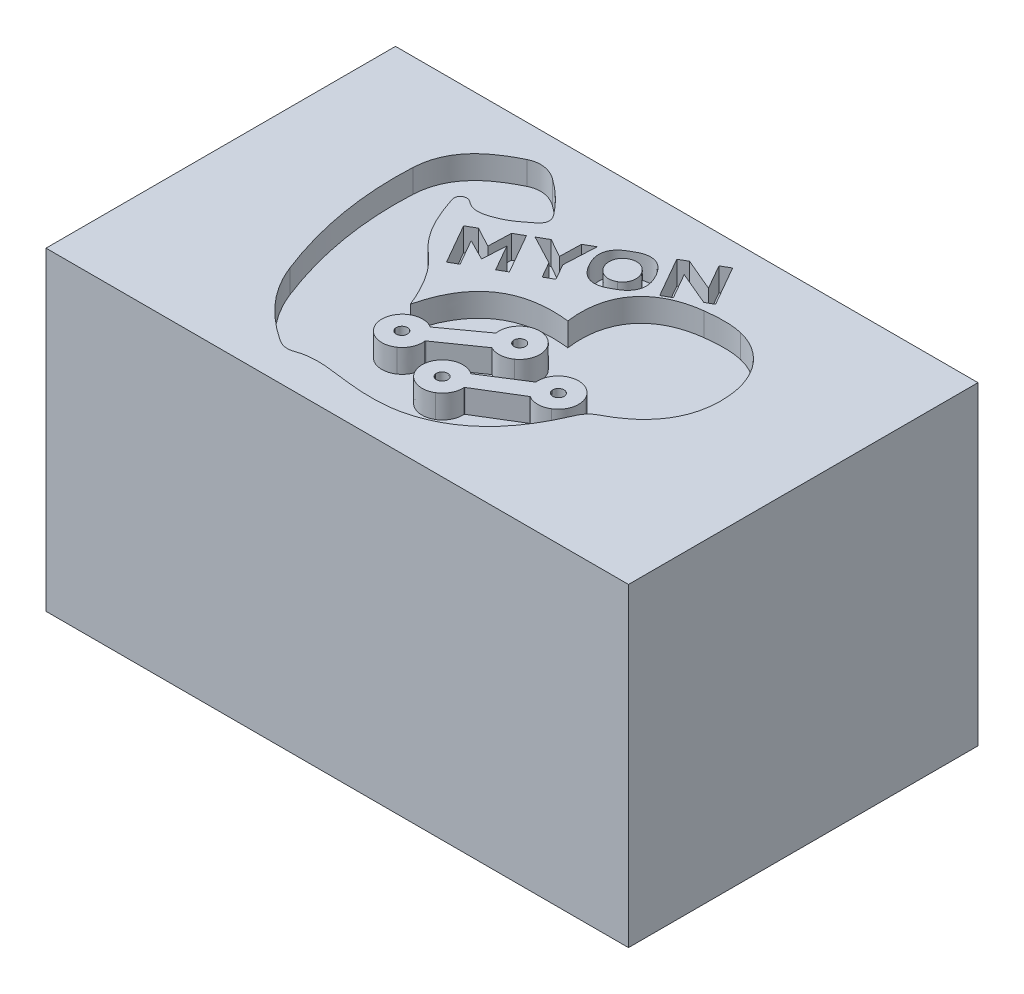
from build123d import *

# Parameters (mm, degrees)
SKETCH1_W               = 127
SKETCH1_H               = 76.2
BOSS_EXTRUDE1_DEPTH     = 63.5
SKETCH3_W               = 114.3
SKETCH3_H               = 63.5
CUT_EXTRUDE1_DEPTH      = 57.15
BOSS_EXTRUDE3_OUTLINE_W = 127
BOSS_EXTRUDE3_OUTLINE_H = 76.2
BOSS_EXTRUDE3_DEPTH     = 5.08


with BuildPart() as part:
    # Sketch1 → Boss-Extrude1 (new body)
    with BuildSketch(Plane(origin=(0, 0, 0), x_dir=(1, 0, 0), z_dir=(0, 1, 0))):
        with Locations((63.5, 38.1)):
            Rectangle(SKETCH1_W, SKETCH1_H)
    extrude(amount=BOSS_EXTRUDE1_DEPTH)

    # Sketch3 → Cut-Extrude1 (cut)
    with BuildSketch(Plane(origin=(0, 0, 0), x_dir=(1, 0, 0), z_dir=(0, 1, 0))):
        with Locations((63.5, 38.1)):
            Rectangle(SKETCH3_W, SKETCH3_H)
    extrude(amount=CUT_EXTRUDE1_DEPTH, mode=Mode.SUBTRACT)

    # Boss-Extrude3: read off the stored shape, not the designer's step
    # Boss-Extrude3 outline → Boss-Extrude3 (add)
    # profile 1 of 4: a face of its own
    with BuildSketch(Plane(origin=(0, 63.5, 0), x_dir=(1, 0, 0), z_dir=(0, 1, 0))):
        with Locations((63.5, 38.1)):
            Rectangle(BOSS_EXTRUDE3_OUTLINE_W, BOSS_EXTRUDE3_OUTLINE_H)
        Polygon((48.177404427, 42.102624982), (46.297457161, 41.025853497), (41.305513802, 49.740980451), (43.371992318, 50.924660138), (47.773832161, 48.551595685), (47.953666146, 53.548996076), (50.020392708, 54.73292381), (55.012584114, 46.017796857), (53.107584114, 44.926638654), (49.848496224, 50.616585919), (49.528267708, 45.488712872), (49.478410286, 45.460187482), (44.939896614, 47.755117169), align=None, mode=Mode.SUBTRACT)
        Polygon((61.472716927, 49.718160138), (59.555314583, 48.619808576), (57.587310677, 52.056001935), (51.214242318, 55.416665021), (53.455345833, 56.700431622), (57.538445443, 54.392851544), (57.651058724, 59.103633771), (59.829654427, 60.351681622), (59.483132943, 53.191808576), align=None, mode=Mode.SUBTRACT)
        with BuildLine():
            add(Edge.make_bspline(
                [(35.229008249, 53.016042263), (36.810412932, 48.331334892), (38.815520547, 43.941861019), (42.732961798, 40.625926577)],
                knots=[20, 20, 20, 20, 21, 21, 21, 21], degree=3))
            add(Edge.make_bspline(
                [(42.732961798, 40.625926577), (46.174479681, 37.712844661), (48.350409564, 33.84066896), (50.300186284, 29.158608863)],
                knots=[21, 21, 21, 21, 22, 22, 22, 22], degree=3))
            add(Edge.make_bspline(
                [(50.300186284, 29.158608863), (53.035865156, 40.454808583), (60.183824369, 44.34521592), (70.626650277, 43.14566193)],
                knots=[0, 0, 0, 0, 1, 1, 1, 1], degree=3))
            add(Edge.make_bspline(
                [(70.626650277, 43.14566193), (69.316879866, 52.732156773), (74.057486423, 58.746546124), (83.607810157, 59.907520448)],
                knots=[1, 1, 1, 1, 2, 2, 2, 2], degree=3))
            add(Edge.make_bspline(
                [(83.607810157, 59.907520448), (86.330192084, 60.238461871), (89.038920771, 60.384929568), (91.724960567, 59.744119812)],
                knots=[2, 2, 2, 2, 3, 3, 3, 3], degree=3))
            add(Edge.make_bspline(
                [(91.724960567, 59.744119812), (97.590174376, 58.344847996), (101.705528817, 53.258483471), (102.320501811, 46.710411704)],
                knots=[3, 3, 3, 3, 4, 4, 4, 4], degree=3))
            add(Edge.make_bspline(
                [(102.320501811, 46.710411704), (103.054427589, 38.895667019), (99.573692271, 32.838677208), (91.891884964, 28.830866973)],
                knots=[4, 4, 4, 4, 5, 5, 5, 5], degree=3))
            add(Edge.make_bspline(
                [(91.891884964, 28.830866973), (90.557074112, 28.134462664), (89.804364441, 27.246285916), (89.216355883, 25.88079803)],
                knots=[5, 5, 5, 5, 6, 6, 6, 6], degree=3))
            add(Edge.make_bspline(
                [(89.216355883, 25.88079803), (85.740551693, 17.809171484), (80.631532125, 11.281020194), (71.900171193, 8.417880204)],
                knots=[6, 6, 6, 6, 7, 7, 7, 7], degree=3))
            add(Edge.make_bspline(
                [(71.900171193, 8.417880204), (66.656336569, 6.698355826), (61.280095447, 7.154948387), (55.953917393, 7.841600891)],
                knots=[7, 7, 7, 7, 8, 8, 8, 8], degree=3))
            add(Edge.make_bspline(
                [(55.953917393, 7.841600891), (52.767799182, 8.252352485), (49.645575426, 8.71344862), (46.534514405, 7.562792611)],
                knots=[8, 8, 8, 8, 9, 9, 9, 9], degree=3))
            add(Edge.make_bspline(
                [(46.534514405, 7.562792611), (45.162297881, 7.055271185), (43.949277705, 7.442101106), (42.79459734, 8.211064974)],
                knots=[9, 9, 9, 9, 10, 10, 10, 10], degree=3))
            add(Edge.make_bspline(
                [(42.79459734, 8.211064974), (37.236219789, 11.912639309), (32.792959561, 16.53366244), (30.310937186, 22.881036568)],
                knots=[10, 10, 10, 10, 11, 11, 11, 11], degree=3))
            add(Edge.make_bspline(
                [(30.310937186, 22.881036568), (26.236546919, 33.300653393), (24.201349267, 44.064202172), (24.770811758, 55.257268624)],
                knots=[11, 11, 11, 11, 12, 12, 12, 12], degree=3))
            add(Edge.make_bspline(
                [(24.770811758, 55.257268624), (25.133856288, 62.393087071), (29.855261195, 66.300015826), (35.680030132, 69.154348193)],
                knots=[12, 12, 12, 12, 13, 13, 13, 13], degree=3))
            add(Edge.make_bspline(
                [(35.680030132, 69.154348193), (37.838651185, 70.212144713), (40.120441777, 69.722781882), (42.095841481, 68.322352105)],
                knots=[13, 13, 13, 13, 14, 14, 14, 14], degree=3))
            add(Edge.make_bspline(
                [(42.095841481, 68.322352105), (44.712002841, 66.467667066), (47.008601071, 64.271875495), (48.982213953, 61.732168003)],
                knots=[14, 14, 14, 14, 15, 15, 15, 15], degree=3))
            add(Edge.make_bspline(
                [(48.982213953, 61.732168003), (50.034938607, 60.377486557), (50.013225965, 59.282811682), (48.615618048, 58.146462715)],
                knots=[15, 15, 15, 15, 16, 16, 16, 16], degree=3))
            add(Edge.make_bspline(
                [(48.615618048, 58.146462715), (46.792832137, 56.664412787), (44.930882234, 55.268228271), (42.6818726, 54.523599379)],
                knots=[16, 16, 16, 16, 17, 17, 17, 17], degree=3))
            add(Edge.make_bspline(
                [(42.6818726, 54.523599379), (40.961261521, 53.953915093), (39.222577358, 53.54979772), (37.58608228, 54.864050327)],
                knots=[17, 17, 17, 17, 18, 18, 18, 18], degree=3))
            add(Edge.make_bspline(
                [(37.58608228, 54.864050327), (36.939728568, 55.383129976), (36.136168416, 55.546548426), (35.442088935, 54.965391428)],
                knots=[18, 18, 18, 18, 19, 19, 19, 19], degree=3))
            add(Edge.make_bspline(
                [(35.442088935, 54.965391428), (34.80601969, 54.432808184), (35.001180497, 53.690961959), (35.229008249, 53.016042263)],
                knots=[19, 19, 19, 19, 20, 20, 20, 20], degree=3))
        make_face(mode=Mode.SUBTRACT)
        with BuildLine():
            Line((71.635693489, 61.359744122), (71.650080208, 61.334691388))
            add(Edge.make_bspline(
                [(71.650080208, 61.334691388), (73.069404427, 58.857199201), (72.278921121, 55.716419755), (70.493338685, 54.686719627), (69.601529763, 54.175874628)],
                knots=[0, 0, 0, 0, 1, 1.99488597, 1.99488597, 1.99488597, 1.99488597], degree=3))
            add(Edge.make_bspline(
                [(69.601529763, 54.175874628), (69.596964834, 54.173244114), (69.592394408, 54.170618254), (69.587818489, 54.167997052)],
                knots=[4.998298331, 4.998298331, 4.998298331, 4.998298331, 5, 5, 5, 5], degree=3))
            add(Edge.make_bspline(
                [(69.587818489, 54.167997052), (69.58321471, 54.165360134), (69.578609792, 54.162730364), (69.574003744, 54.160107739)],
                knots=[5, 5, 5, 5, 5.001711872, 5.001711872, 5.001711872, 5.001711872], degree=3))
            add(Edge.make_bspline(
                [(69.574003744, 54.160107739), (68.68218599, 53.649293073), (66.89061189, 52.629928294), (63.820480599, 53.526671857), (62.401404427, 56.004412091)],
                knots=[2.005121732, 2.005121732, 2.005121732, 2.005121732, 3, 4, 4, 4, 4], degree=3))
            Line((62.401404427, 56.004412091), (62.387017708, 56.028968732))
            add(Edge.make_bspline(
                [(62.387017708, 56.028968732), (60.968189583, 58.506708966), (61.760203255, 61.655912091), (64.449527474, 63.196283185), (67.138603646, 64.736654279), (70.216617318, 63.83723631), (71.635693489, 61.359744122)],
                knots=[0, 0, 0, 0, 1, 2, 3, 4, 4, 4, 4], degree=3))
        make_face(mode=Mode.SUBTRACT)
        Polygon((77.742607552, 59.037529279), (75.850257943, 57.953564435), (70.858314583, 66.668691388), (72.625896614, 67.681218732), (79.783537239, 64.654302716), (76.709740364, 70.020300763), (78.602338021, 71.104265607), (83.59428138, 62.389138654), (81.963373177, 61.454994122), (74.569095833, 64.577904279), align=None, mode=Mode.SUBTRACT)
    # profile 2 of 4: a face of its own
    with BuildSketch(Plane(origin=(0, 63.5, 0), x_dir=(1, 0, 0), z_dir=(0, 1, 0))):
        with BuildLine():
            Line((64.377345833, 57.202230451), (64.391732552, 57.177177716))
            add(Edge.make_bspline(
                [(64.391732552, 57.177177716), (65.247494271, 55.683191388), (67.056252083, 55.065802716), (68.600095833, 55.950089826)],
                knots=[4, 4, 4, 4, 5, 5, 5, 5], degree=3))
            add(Edge.make_bspline(
                [(68.600095833, 55.950089826), (70.143939583, 56.834376935), (70.515513802, 58.667815411), (69.659752083, 60.162049786)],
                knots=[5, 5, 5, 5, 6, 6, 6, 6], degree=3))
            Line((69.659752083, 60.162049786), (69.645613411, 60.186606427))
            add(Edge.make_bspline(
                [(69.645613411, 60.186606427), (68.789603646, 61.680840802), (66.98109388, 62.298229474), (65.43725013, 61.413942365)],
                knots=[1, 1, 1, 1, 2, 2, 2, 2], degree=3))
            add(Edge.make_bspline(
                [(65.43725013, 61.413942365), (63.89340638, 60.529655255), (63.521584114, 58.696216779), (64.377345833, 57.202230451)],
                knots=[2, 2, 2, 2, 3, 3, 3, 3], degree=3))
        make_face()
    # profile 3 of 4: a face of its own
    with BuildSketch(Plane(origin=(0, 63.5, 0), x_dir=(1, 0, 0), z_dir=(0, 1, 0))):
        with BuildLine():
            add(Edge.make_bspline(
                [(80.888400373, 24.706120166), (80.860531862, 24.722168752), (80.806318726, 24.756051993)],
                knots=[15, 15, 15, 16, 16, 16], degree=2))
            add(Edge.make_bspline(
                [(85.430007023, 24.765028015), (83.992544696, 23.885694795), (82.252597934, 23.920522281), (80.888400373, 24.706120166)],
                knots=[14, 14, 14, 14, 15, 15, 15, 15], degree=3))
            add(Edge.make_bspline(
                [(86.902263928, 30.876370716), (88.183312097, 28.78221751), (87.524160228, 26.046076184), (85.430007023, 24.765028015)],
                knots=[13, 13, 13, 13, 14, 14, 14, 14], degree=3))
            add(Edge.make_bspline(
                [(80.790921227, 32.348627621), (82.885074433, 33.62967579), (85.621215759, 32.970523921), (86.902263928, 30.876370716)],
                knots=[12, 12, 12, 12, 13, 13, 13, 13], degree=3))
            add(Edge.make_bspline(
                [(78.68823876, 28.097343599), (78.518012846, 29.746891252), (79.281914102, 31.42552858), (80.790921227, 32.348627621)],
                knots=[11, 11, 11, 11, 12, 12, 12, 12], degree=3))
            add(Edge.make_bspline(
                [(70.120942364, 22.672218689), (71.076054841, 23.276990174), (78.686201693, 28.095700542), (78.688238359, 28.097343183), (78.688238507, 28.097343303), (78.688238656, 28.097343423), (78.68823876, 28.097343599)],
                knots=[10, 10, 10, 10, 10.9998478, 10.9998478, 10.9998478, 10.999920778, 10.999920778, 10.999920778, 10.999920778], degree=3))
            Line((70.120942364, 22.672218689), (70.022877884, 22.610124898))
            add(Edge.make_bspline(
                [(69.910538964, 22.687664211), (69.948308815, 22.662691589), (70.022877884, 22.610124898)],
                knots=[8, 8, 8, 9, 9, 9], degree=2))
            add(Edge.make_bspline(
                [(65.136433452, 22.772368898), (66.656924383, 23.702492883), (68.515852253, 23.609801427), (69.910538964, 22.687664211)],
                knots=[7, 7, 7, 7, 8, 8, 8, 8], degree=3))
            add(Edge.make_bspline(
                [(63.664176547, 16.661026198), (62.383128378, 18.755179403), (63.042280247, 21.491320729), (65.136433452, 22.772368898)],
                knots=[6, 6, 6, 6, 7, 7, 7, 7], degree=3))
            add(Edge.make_bspline(
                [(69.775519248, 15.188769293), (67.681366042, 13.907721124), (64.945224716, 14.566872992), (63.664176547, 16.661026198)],
                knots=[5, 5, 5, 5, 6, 6, 6, 6], degree=3))
            add(Edge.make_bspline(
                [(71.897664517, 19.172028952), (71.963536984, 17.610974898), (71.202836789, 16.061896683), (69.775519248, 15.188769293)],
                knots=[4, 4, 4, 4, 5, 5, 5, 5], degree=3))
            add(Edge.make_bspline(
                [(71.8890736, 19.318245202), (71.892746059, 19.269508248), (71.895608075, 19.220762764), (71.897664517, 19.172028952)],
                knots=[3, 3, 3, 3, 4, 4, 4, 4], degree=3))
            Line((71.8890736, 19.318245202), (72.009826973, 19.39246082))
            Line((72.009826973, 19.39246082), (80.806318726, 24.756051993))
        make_face()
        with BuildLine():
            add(Edge.make_bspline(
                [(66.189170149, 18.754168867), (66.08941144, 19.429975412), (66.556390478, 20.058695275), (67.232197024, 20.158453985), (67.90800357, 20.258212694), (68.536723433, 19.791233656), (68.636482142, 19.11542711)],
                knots=[0, 0, 0, 0, 1, 1, 1, 2, 2, 2, 2], degree=3))
            add(Edge.make_bspline(
                [(68.636482142, 19.11542711), (68.736240852, 18.439620564), (68.269261813, 17.810900701), (67.593455268, 17.711141992), (66.917648722, 17.611383283), (66.288928859, 18.078362321), (66.189170149, 18.754168867)],
                knots=[2, 2, 2, 2, 3, 3, 3, 4, 4, 4, 4], degree=3))
        make_face(mode=Mode.SUBTRACT)
        with BuildLine():
            add(Edge.make_bspline(
                [(82.00370618, 28.301495139), (81.903947471, 28.977301685), (82.370926509, 29.606021548), (83.046733055, 29.705780258), (83.722539601, 29.805538967), (84.351259463, 29.338559929), (84.451018173, 28.662753383)],
                knots=[0, 0, 0, 0, 1, 1, 1, 2, 2, 2, 2], degree=3))
            add(Edge.make_bspline(
                [(84.451018173, 28.662753383), (84.550776882, 27.986946837), (84.083797844, 27.358226974), (83.407991298, 27.258468265), (82.732184752, 27.158709555), (82.103464889, 27.625688594), (82.00370618, 28.301495139)],
                knots=[2, 2, 2, 2, 3, 3, 3, 4, 4, 4, 4], degree=3))
        make_face(mode=Mode.SUBTRACT)
    # profile 4 of 4: a face of its own
    with BuildSketch(Plane(origin=(0, 63.5, 0), x_dir=(1, 0, 0), z_dir=(0, 1, 0))):
        with BuildLine():
            add(Edge.make_bspline(
                [(67.49912133, 29.763798095), (67.470315206, 29.778095585), (67.414113671, 29.808567303)],
                knots=[15, 15, 15, 16, 16, 16], degree=2))
            add(Edge.make_bspline(
                [(72.028428264, 30.10297326), (70.647994191, 29.13657447), (68.909216228, 29.063918533), (67.49912133, 29.763798095)],
                knots=[14, 14, 14, 14, 15, 15, 15, 15], degree=3))
            add(Edge.make_bspline(
                [(73.120588301, 36.293549683), (74.52847711, 34.282477542), (74.039500406, 31.510862069), (72.028428264, 30.10297326)],
                knots=[13, 13, 13, 13, 14, 14, 14, 14], degree=3))
            add(Edge.make_bspline(
                [(66.930011877, 37.38570972), (68.941084019, 38.793598529), (71.712699491, 38.304621825), (73.120588301, 36.293549683)],
                knots=[12, 12, 12, 12, 13, 13, 13, 13], degree=3))
            add(Edge.make_bspline(
                [(65.093796604, 33.012724142), (64.822059262, 34.648616295), (65.480871392, 36.371211717), (66.930011877, 37.38570972)],
                knots=[11, 11, 11, 11, 12, 12, 12, 12], degree=3))
            add(Edge.make_bspline(
                [(56.877766477, 27.069038689), (57.793721056, 27.731621214), (65.091864858, 33.01095846), (65.093796229, 33.012723703), (65.09379637, 33.012723831), (65.093796511, 33.01272396), (65.093796604, 33.012724142)],
                knots=[10, 10, 10, 10, 10.9998478, 10.9998478, 10.9998478, 10.999920778, 10.999920778, 10.999920778, 10.999920778], degree=3))
            Line((56.877766477, 27.069038689), (56.783722461, 27.001009253))
            add(Edge.make_bspline(
                [(56.666810874, 27.071465329), (56.706050384, 27.048872093), (56.783722461, 27.001009253)],
                knots=[8, 8, 8, 9, 9, 9], degree=2))
            add(Edge.make_bspline(
                [(51.896582529, 26.861275262), (53.356751224, 27.883493771), (55.217855619, 27.905741505), (56.666810874, 27.071465329)],
                knots=[7, 7, 7, 7, 8, 8, 8, 8], degree=3))
            add(Edge.make_bspline(
                [(50.804422493, 20.670698839), (49.396533684, 22.681770981), (49.885510387, 25.453386453), (51.896582529, 26.861275262)],
                knots=[6, 6, 6, 6, 7, 7, 7, 7], degree=3))
            add(Edge.make_bspline(
                [(56.994998916, 19.578538802), (54.983926775, 18.170649993), (52.212311302, 18.659626697), (50.804422493, 20.670698839)],
                knots=[5, 5, 5, 5, 6, 6, 6, 6], degree=3))
            add(Edge.make_bspline(
                [(58.867186562, 23.685212818), (59.029306288, 22.131203123), (58.365690677, 20.538117303), (56.994998916, 19.578538802)],
                knots=[4, 4, 4, 4, 5, 5, 5, 5], degree=3))
            add(Edge.make_bspline(
                [(58.849585257, 23.830619798), (58.856259525, 23.78220253), (58.862125423, 23.733726716), (58.867186562, 23.685212818)],
                knots=[3, 3, 3, 3, 4, 4, 4, 4], degree=3))
            Line((58.849585257, 23.830619798), (58.965526536, 23.912148656))
            Line((58.965526536, 23.912148656), (67.414113671, 29.808567303))
        make_face()
        with BuildLine():
            add(Edge.make_bspline(
                [(53.195377918, 22.915731373), (53.054088044, 23.584090153), (53.481361814, 24.24044007), (54.149720594, 24.381729944), (54.818079374, 24.523019818), (55.474429291, 24.095746048), (55.615719166, 23.427387268)],
                knots=[0, 0, 0, 0, 1, 1, 1, 2, 2, 2, 2], degree=3))
            add(Edge.make_bspline(
                [(55.615719166, 23.427387268), (55.75700904, 22.759028488), (55.32973527, 22.102678571), (54.66137649, 21.961388697), (53.99301771, 21.820098823), (53.336667792, 22.247372593), (53.195377918, 22.915731373)],
                knots=[2, 2, 2, 2, 3, 3, 3, 4, 4, 4, 4], degree=3))
        make_face(mode=Mode.SUBTRACT)
        with BuildLine():
            add(Edge.make_bspline(
                [(68.390336402, 33.421169274), (68.249046528, 34.089528054), (68.676320298, 34.745877971), (69.344679078, 34.887167846), (70.013037858, 35.02845772), (70.669387775, 34.60118395), (70.810677649, 33.93282517)],
                knots=[0, 0, 0, 0, 1, 1, 1, 2, 2, 2, 2], degree=3))
            add(Edge.make_bspline(
                [(70.810677649, 33.93282517), (70.951967523, 33.26446639), (70.524693753, 32.608116472), (69.856334973, 32.466826598), (69.187976193, 32.325536724), (68.531626276, 32.752810494), (68.390336402, 33.421169274)],
                knots=[2, 2, 2, 2, 3, 3, 3, 4, 4, 4, 4], degree=3))
        make_face(mode=Mode.SUBTRACT)
    extrude(amount=BOSS_EXTRUDE3_DEPTH)


solid = part.part
